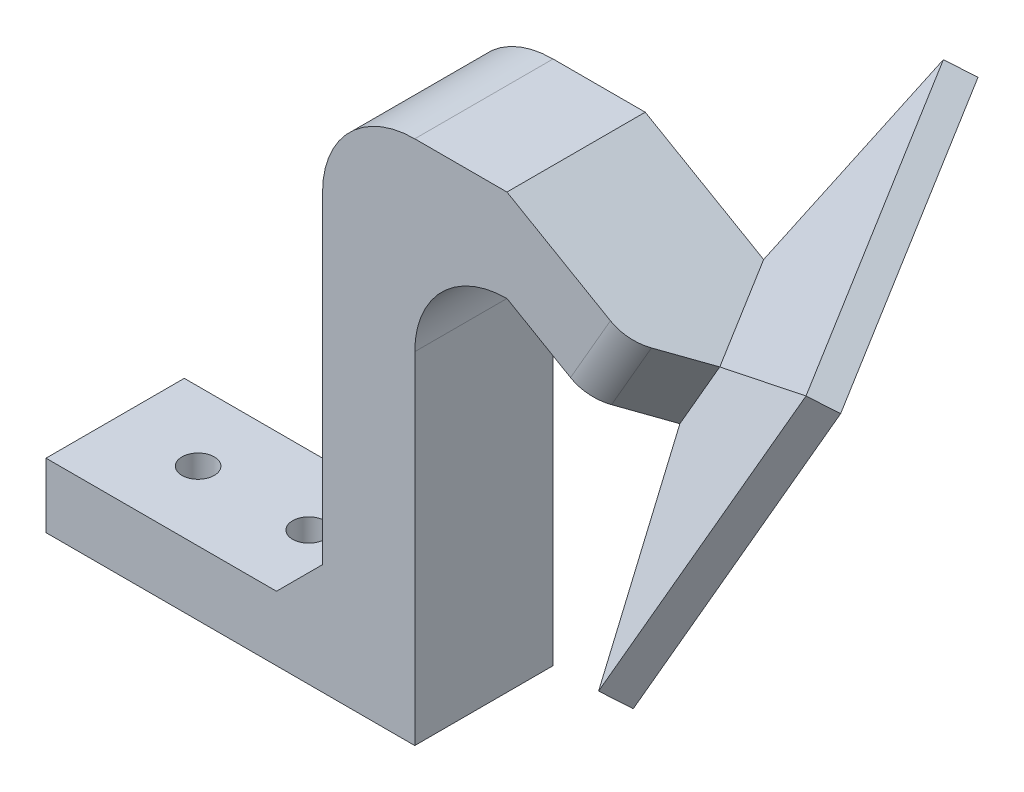
from build123d import *

# Parameters (mm, degrees)
SKETCH_1_W               = 40
SKETCH_1_H               = 15
EXTRUDE_1_DEPTH          = 7
SKETCH_3_W               = 10
SKETCH_3_H               = 6
EXTRUDE_2_DEPTH          = 50
EXTRUDE_5_DEPTH          = 6
FILLET_1_R               = 10
SKETCH_7_R               = 1.75
CUT_EXTRUDE_3_DEPTH      = 10
SKETCH_16_W              = 6
SKETCH_16_H              = 8.660254038
EXTRUDE_11_DEPTH         = 10
EXTRUDE_12_DEPTH         = 8.66
EXTRUDE_14_DEPTH         = 3
EXTRUDE_15_DEPTH         = 4.5
EXTRUDE_15_DEPTH_BACK    = 10.5
EXTRUDE_17_DEPTH         = 8.66
EXTRUDE_22_DEPTH         = 8.66
EXTRUDE_23_DEPTH         = 15
FILLET_2_R               = 10
EXTRUDE_24_DEPTH         = 35
CUT_EXTRUDE_4_DEPTH      = 35
CUT_EXTRUDE_4_DEPTH_BACK = 35
CUT_EXTRUDE_5_DEPTH      = 35
CUT_EXTRUDE_5_DEPTH_BACK = 35
FILLET_3_R               = 5


with BuildPart() as part:
    # 草图1 → 凸台-拉伸1 (new body)
    with BuildSketch(Plane(origin=(0, 0, 0), x_dir=(1, 0, 0), z_dir=(0, 1, 0))):
        with Locations((-15, 0)):
            Rectangle(SKETCH_1_W, SKETCH_1_H)
    extrude(amount=EXTRUDE_1_DEPTH)

    # 草图3 → 凸台-拉伸2 (add)
    with BuildSketch(Plane(origin=(0, 7, 0), x_dir=(1, 0, 0), z_dir=(0, 1, 0))):
        Rectangle(SKETCH_3_W, SKETCH_3_H)
    extrude(amount=EXTRUDE_2_DEPTH)

    # 草图4 → 凸台-拉伸5 (add)
    with BuildSketch(Plane.XY.offset(3)):
        Polygon((5, 57), (5, 47), (15, 47), (19.330127019, 54.5), (15, 57), align=None)
    extrude(amount=-EXTRUDE_5_DEPTH)

    # 圆角1
    fillet_1_edges = [part.edges().sort_by_distance(p)[0] for p in [
        (-5, 57, 0),
    ]]
    fillet(fillet_1_edges, radius=FILLET_1_R)

    # 草图7 → 切除-拉伸3 (cut)
    with BuildSketch(Plane(origin=(0, 7, 0), x_dir=(1, 0, 0), z_dir=(0, 1, 0))):
        with Locations(Location((-26, 0, 0), (0, 0, 270))):
            Circle(SKETCH_7_R)
        with Locations(Location((-14, 0, 0), (0, 0, 270))):
            Circle(SKETCH_7_R)
    extrude(amount=-CUT_EXTRUDE_3_DEPTH, mode=Mode.SUBTRACT)

    # 草图16 → 凸台-拉伸11 (add)
    with BuildSketch(Plane(origin=(-9.101596989, 5.254809472, 0), x_dir=(0, 0, -1), z_dir=(0.8660254037844403, -0.4999999999999973, 0))):
        with Locations((0, 52.533320997)):
            Rectangle(SKETCH_16_W, SKETCH_16_H)
    extrude(amount=EXTRUDE_11_DEPTH)

    # 草图17 → 凸台-拉伸12 (add)
    with BuildSketch(Plane(origin=(28.431724008, 49.245190528, 0), x_dir=(0.8660254037844402, -0.4999999999999975, 0), z_dir=(0.4999999999999975, 0.8660254037844402, 0))):
        Polygon((-0.509618943, -3), (6.561448869, 4.071067812), (4.387416664, 7.7860808), (-0.509618943, 3), align=None)
    extrude(amount=-EXTRUDE_12_DEPTH)

    # 草图19 → 凸台-拉伸14 (add)
    with BuildSketch(Plane(origin=(5.769699285, -3.331137436, -3.898775098), x_dir=(-0.6556667796433489, -0.35687658637483116, -0.6653872377567577), z_dir=(0.7474459160042376, -0.43153810080973004, -0.5050737274875003))):
        Polygon((-33.928130068, 69.297295246), (-5.267738986, 34.604616147), (-32.250933841, 12.313200861), (-60.911324922, 47.00587996), align=None)
    extrude(amount=EXTRUDE_14_DEPTH)

    # 草图20 → 凸台-拉伸15 (add, two sides: drawn at the far end of the back side and taken through both)
    with BuildSketch(Plane(origin=(0, 0, -3), x_dir=(-1, 0, 0), z_dir=(0, 0, -1)).offset(-EXTRUDE_15_DEPTH_BACK)):
        with BuildLine():
            Line((-5, 7), (5, 7))
            Line((5, 7), (5, 47))
            ThreePointArc((5, 47), (2.071067812, 54.071067812), (-5, 57))
            Line((-5, 57), (-15, 57))
            Line((-15, 57), (-27.990381057, 49.5))
            Line((-27.990381057, 49.5), (-23.660381057, 42.000220003))
            Line((-23.660381057, 42.000220003), (-15, 47))
            Line((-15, 47), (-5, 47))
            Line((-5, 47), (-5, 7))
        make_face()
    extrude(amount=EXTRUDE_15_DEPTH + EXTRUDE_15_DEPTH_BACK)

    # 草图21 → 凸台-拉伸17 (add)
    with BuildSketch(Plane(origin=(28.431724008, 49.245190528, 0), x_dir=(0.8660254037844402, -0.4999999999999975, 0), z_dir=(0.4999999999999975, 0.8660254037844402, 0))):
        Polygon((-0.509618943, 7.5), (-0.509618943, 3), (4.387416664, 7.7860808), align=None)
        Polygon((-0.509618943, -7.5), (8.29635004, 1.106447339), (6.561448869, 4.071067812), (-0.509618943, -3), align=None)
    extrude(amount=-EXTRUDE_17_DEPTH)

    # 草图22 → 凸台-拉伸22 (add)
    with BuildSketch(Plane(origin=(28.431724008, 49.245190528, 0), x_dir=(0.8660254037844402, -0.4999999999999975, 0), z_dir=(0.4999999999999975, 0.8660254037844402, 0))):
        Polygon((4.387416664, 7.7860808), (-2.41816344, 19.41553984), (-0.509618943, 7.5), align=None)
        Polygon((8.29635004, 1.106447339), (15.259417022, -10.792127217), (4.967687183, -2.146796188), align=None)
    extrude(amount=-EXTRUDE_22_DEPTH)

    # 草图23 → 凸台-拉伸23 (add)
    with BuildSketch(Plane.XY.offset(7.5)):
        Polygon((-5, 7), (-10, 7), (-5, 12), align=None)
    extrude(amount=-EXTRUDE_23_DEPTH)

    # 圆角2
    fillet_2_edges = [part.edges().sort_by_distance(p)[0] for p in [
        (5, 47, 0),
    ]]
    fillet(fillet_2_edges, radius=FILLET_2_R - 0.0001)  # a hair under: the kernel refuses the full size


with BuildPart() as extrude_24_tool:
    # 草图24 → 凸台-拉伸24 (new body)
    with BuildSketch(Plane(origin=(7.445343505, -4.298571076, 14.690902319), x_dir=(0.8992638085264243, 0.12283526789294275, -0.4198048351748937), z_dir=(0.43740667881795164, -0.25253686369234724, 0.8630762016194644))):
        Polygon((34.27908934, 45.482482988), (38.032691816, 42.971530425), (48.135364869, 58.073933853), align=None)
        Polygon((29.464039564, 38.284504407), (33.21764204, 35.773551844), (23.114898365, 20.671042842), align=None)
    extrude(amount=-EXTRUDE_24_DEPTH)


with BuildPart() as part_1:
    add(part.part)


with BuildPart() as part_2:
    # 凸台-拉伸24: joined with extrude_24_tool
    add(part_1.part.fuse(extrude_24_tool.part, tol=0.00001))

    # 草图25 → 切除-拉伸4 (cut, two sides: drawn at the far end of the back side and taken through both)
    with BuildSketch(Plane(origin=(28.431724014, 49.245190525, -8e-09), x_dir=(0.866025403727626, -0.5000000000984025, 7.809544934800217e-11), z_dir=(-0.5000000000984025, -0.866025403727626, 1.35265286075167e-10)).offset(-CUT_EXTRUDE_4_DEPTH_BACK)):
        Polygon((11.361749763, 13.073049031), (15.259417021, 10.792127222), (4.967687177, 2.146796194), align=None)
    extrude(amount=CUT_EXTRUDE_4_DEPTH + CUT_EXTRUDE_4_DEPTH_BACK, mode=Mode.SUBTRACT)

    # 草图26 → 切除-拉伸5 (cut, two sides: drawn at the far end of the back side and taken through both)
    with BuildSketch(Plane(origin=(24.101724013, 41.745410529, -7e-09), x_dir=(0.8660254037276265, -0.5000000000984015, 7.809507734629167e-11), z_dir=(0.5000000000984015, 0.8660254037276265, -1.3526464174930455e-10)).offset(-CUT_EXTRUDE_5_DEPTH_BACK)):
        Polygon((-0.677635102, 7.499999992), (-2.41816345, 19.415539829), (-6.315830703, 17.134618023), align=None)
    extrude(amount=CUT_EXTRUDE_5_DEPTH + CUT_EXTRUDE_5_DEPTH_BACK, mode=Mode.SUBTRACT)

    # 圆角3
    fillet_3_edges = [part_2.edges().sort_by_distance(p)[0] for p in [
        (25.825381057, 45.750110002, 7.5),
    ]]
    fillet(fillet_3_edges, radius=FILLET_3_R)


solid = part_2.part
